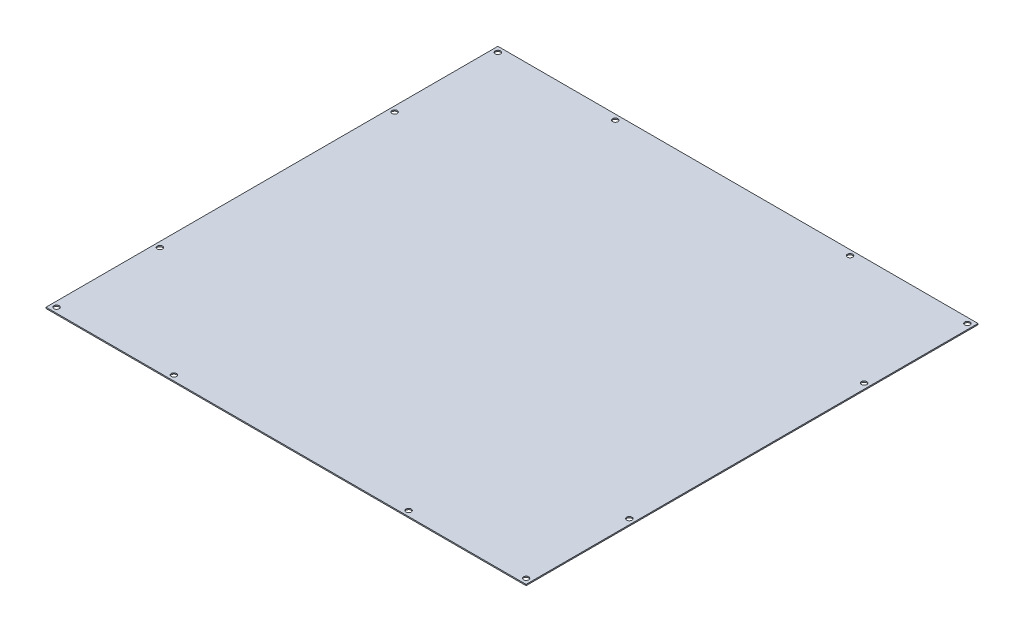
from build123d import *

# Parameters (mm, degrees)
SKETCH1_W            = 409
SKETCH1_H            = 385
BOSS_EXTRUDE1_DEPTH  = 1
M4_CLEARANCE_HOLE1_D = 4.5


with BuildPart() as part:
    # Sketch1 → Boss-Extrude1 (new body)
    with BuildSketch(Plane(origin=(0, 0, 0), x_dir=(1, 0, 0), z_dir=(0, 1, 0))):
        Rectangle(SKETCH1_W, SKETCH1_H)
    extrude(amount=BOSS_EXTRUDE1_DEPTH)

    # M4 Clearance Hole1 (through all)
    with Locations(Plane(origin=(0, 1, 0), x_dir=(1, 0, 0), z_dir=(0, 1, 0))):
        with Locations((-200, 188), (-200, 100), (-200, -100), (200, -100), (200, 100), (200, 188), (-100, 188), (100, 188), (100, -188), (-100, -188), (200, -188), (-200, -188)):
            Hole(M4_CLEARANCE_HOLE1_D / 2)


solid = part.part
